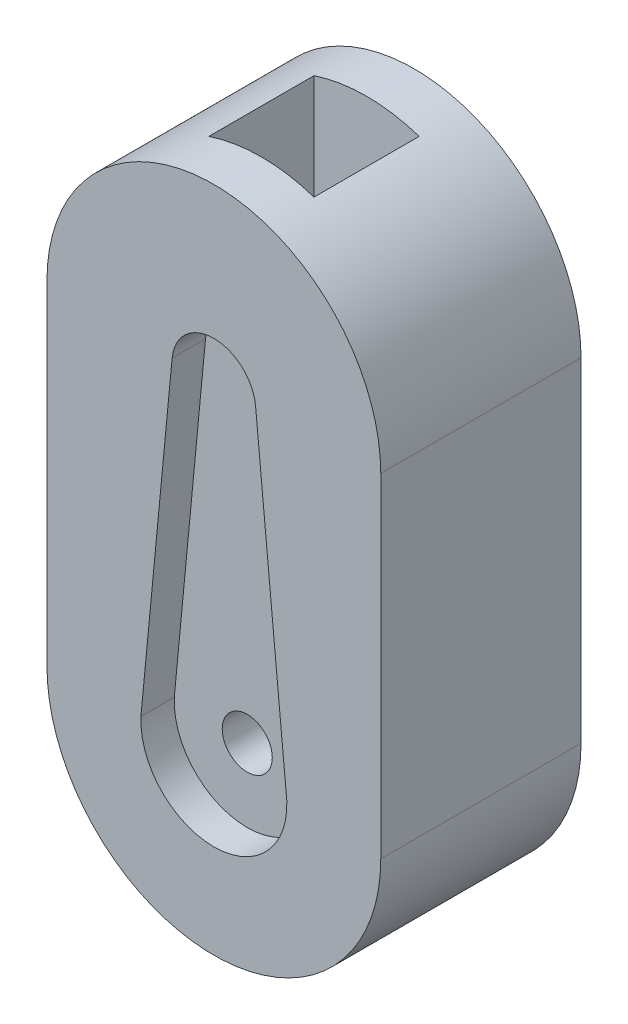
from build123d import *

# Parameters (mm, degrees)
BOSS_EXTRUDE1_DEPTH = 12
SKETCH4_R           = 1.5
CUT_EXTRUDE2_DEPTH  = 34.823069051
CUT_EXTRUDE1_DEPTH  = 2
SKETCH6_W           = 6.3
SKETCH6_H           = 6.3
CUT_EXTRUDE3_DEPTH  = 30.478805946


with BuildPart() as part:
    # Sketch1 → Boss-Extrude1 (new body)
    with BuildSketch(Plane.XY):
        with BuildLine():
            Line((10, 20), (10, 0))
            ThreePointArc((10, 0), (0, -10), (-10, 0))
            Line((-10, 0), (-10, 20))
            ThreePointArc((-10, 20), (0, 30), (10, 20))
        make_face()
    extrude(amount=-BOSS_EXTRUDE1_DEPTH)

    # Sketch4 → Cut-Extrude2 (cut, through all)
    with BuildSketch(Plane.XY):
        Circle(SKETCH4_R)
    extrude(amount=-CUT_EXTRUDE2_DEPTH, mode=Mode.SUBTRACT)

    # Sketch2 → Cut-Extrude1 (cut)
    with BuildSketch(Plane.XY):
        with BuildLine():
            Line((-2.5, 19.73937205), (-4.37, 0.209105237))
            ThreePointArc((-4.37, 0.209105237), (-0.209105237, -4.37), (4.37, -0.209105237))
            ThreePointArc((4.37, -0.209105237), (4.375, 0), (4.37, 0.209105237))
            Line((4.37, 0.209105237), (2.5, 19.73937205))
            ThreePointArc((2.5, 19.73937205), (0, 22.01143365), (-2.5, 19.73937205))
        make_face()
    cut_extrude1 = extrude(amount=-CUT_EXTRUDE1_DEPTH, mode=Mode.SUBTRACT)

    # Sketch6 → Cut-Extrude3 (cut, through all)
    with BuildSketch(Plane(origin=(0, 5, 0), x_dir=(-1, 0, 0), z_dir=(0, -1, 0))):
        with Locations((0, 6)):
            Rectangle(SKETCH6_W, SKETCH6_H)
    extrude(amount=-CUT_EXTRUDE3_DEPTH, mode=Mode.SUBTRACT)

    # Mirror1: Cut-Extrude1 across plane
    add(cut_extrude1.mirror(Plane.XY.offset(-6)), mode=Mode.SUBTRACT)


solid = part.part
